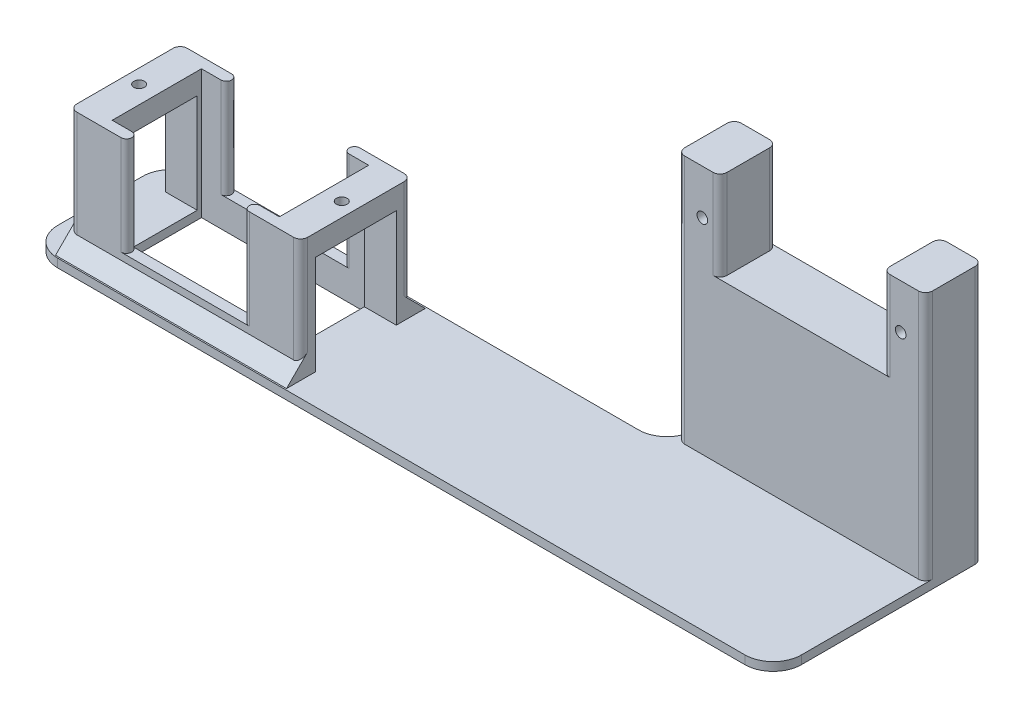
from build123d import *

# Parameters (mm, degrees)
ESBO_O1_W                = 35
ESBO_O1_H                = 9.5
ESBO_O1_W_2              = 105
ESBO_O1_H_2              = 20
BASE_DEPTH               = 1.2
ESBO_O2_W                = 32.6
ESBO_O2_H                = 15.6
SUPORTE_1_DEPTH          = 17
ESBO_O3_W                = 23.6
ESBO_O3_H                = 12.6
CORTE_EXTRUS_O1_DEPTH    = 19.5
ESBO_O4_W                = 16.6
ESBO_O4_H                = 17.237895569
CORTE_EXTRUS_O2_DEPTH    = 19.5
ESBO_O5_W                = 11.4
ESBO_O5_H                = 14
CORTE_EXTRUS_O3_DEPTH    = 36.5
ESBO_O6_R                = 0.75
CORTE_EXTRUS_O4_DEPTH    = 7.5
ESBO_O7_W                = 35
ESBO_O7_H                = 8
RESSALTO_EXTRUS_O3_DEPTH = 35.24
ESBO_O9_W                = 23
ESBO_O9_H                = 25.2
CORTE_EXTRUS_O5_DEPTH    = 22.5
ESBO_O10_R               = 0.75
CORTE_EXTRUS_O6_DEPTH    = 22.5
CHANFRO1_SIZE            = 2
CHANFRO2_SIZE            = 2
FILETE1_R                = 1
FILETE2_R                = 1
FILETE3_R                = 1
FILETE4_R                = 1
FILETE5_R                = 1
FILETE6_R                = 1
FILETE7_R                = 1
FILETE8_R                = 1
FILETE9_RADIUS           = 0.75
FILETE9_LENGTH           = 14
FILETE10_RADIUS          = 0.75
FILETE10_LENGTH          = 14
FILETE11_RADIUS          = 0.75
FILETE11_LENGTH          = 14
FILETE12_RADIUS          = 0.75
FILETE12_LENGTH          = 14
FILETE13_R               = 1
FILETE14_R               = 1
FILETE15_R               = 1
FILETE16_R               = 1
FILETE17_R               = 4
FILETE18_R               = 4
FILETE19_R               = 4
FILETE20_R               = 4


with BuildPart() as part:
    # Esboço1 → Base (new body)
    with BuildSketch(Plane(origin=(0, 0, 0), x_dir=(1, 0, 0), z_dir=(0, 1, 0))):
        with Locations((35, 14.75)):
            Rectangle(ESBO_O1_W, ESBO_O1_H)
        Rectangle(ESBO_O1_W_2, ESBO_O1_H_2)
    extrude(amount=BASE_DEPTH)

    # Esboço2 → Suporte 1 (add)
    with BuildSketch(Plane(origin=(0, 1.2, 0), x_dir=(1, 0, 0), z_dir=(0, 1, 0))):
        with Locations((-32.7, 0)):
            Rectangle(ESBO_O2_W, ESBO_O2_H)
    extrude(amount=SUPORTE_1_DEPTH)

    # Esboço3 → Corte-extrusão1 (cut)
    with BuildSketch(Plane(origin=(0, 18.2, 0), x_dir=(1, 0, 0), z_dir=(0, 1, 0))):
        with Locations((-32.7, 0)):
            Rectangle(ESBO_O3_W, ESBO_O3_H)
    extrude(amount=-CORTE_EXTRUS_O1_DEPTH, mode=Mode.SUBTRACT)

    # Esboço4 → Corte-extrusão2 (cut)
    with BuildSketch(Plane.XY.offset(7.8)):
        with Locations((-32.7, 12.818947785)):
            Rectangle(ESBO_O4_W, ESBO_O4_H)
    extrude(amount=-CORTE_EXTRUS_O2_DEPTH, mode=Mode.SUBTRACT)

    # Esboço5 → Corte-extrusão3 (cut)
    with BuildSketch(Plane(origin=(-16.4, 0, 0), x_dir=(0, 0, -1), z_dir=(1, 0, 0))):
        with Locations((0, 8.2)):
            Rectangle(ESBO_O5_W, ESBO_O5_H)
    extrude(amount=-CORTE_EXTRUS_O3_DEPTH, mode=Mode.SUBTRACT)

    # Esboço6 → Corte-extrusão4 (cut)
    with BuildSketch(Plane(origin=(0, 18.2, 0), x_dir=(1, 0, 0), z_dir=(0, 1, 0))):
        with Locations(Location((-47, 0, 0), (0, 0, 270))):
            Circle(ESBO_O6_R)
        with Locations(Location((-18.4, 0, 0), (0, 0, 270))):
            Circle(ESBO_O6_R)
    extrude(amount=-CORTE_EXTRUS_O4_DEPTH, mode=Mode.SUBTRACT)

    # Esboço7 → Ressalto-extrusão3 (add)
    with BuildSketch(Plane(origin=(0, 1.2, 0), x_dir=(1, 0, 0), z_dir=(0, 1, 0))):
        with Locations((35, 15.5)):
            Rectangle(ESBO_O7_W, ESBO_O7_H)
    extrude(amount=RESSALTO_EXTRUS_O3_DEPTH)

    # Esboço9 → Corte-extrusão5 (cut)
    with BuildSketch(Plane.XY.offset(-11.5)):
        with Locations((35, 36.44)):
            Rectangle(ESBO_O9_W, ESBO_O9_H)
    extrude(amount=-CORTE_EXTRUS_O5_DEPTH, mode=Mode.SUBTRACT)

    # Esboço10 → Corte-extrusão6 (cut)
    with BuildSketch(Plane.XY.offset(-11.5)):
        with Locations((21, 30.14)):
            Circle(ESBO_O10_R)
        with Locations((49, 30.14)):
            Circle(ESBO_O10_R)
    extrude(amount=-CORTE_EXTRUS_O6_DEPTH, mode=Mode.SUBTRACT)

    # Chanfro1
    chanfro1_edges = [part.edges().sort_by_distance(p)[0] for p in [
        (-32.7, 1.2, 7.8),
    ]]
    chamfer(chanfro1_edges, length=CHANFRO1_SIZE)

    # Chanfro2
    chanfro2_edges = [part.edges().sort_by_distance(p)[0] for p in [
        (-32.7, 1.2, -7.8),
    ]]
    chamfer(chanfro2_edges, length=CHANFRO2_SIZE)

    # Filete1
    filete1_edges = [part.edges().sort_by_distance(p)[0] for p in [
        (52.5, 18.22, -19.5),
    ]]
    fillet(filete1_edges, radius=FILETE1_R)

    # Filete2
    filete2_edges = [part.edges().sort_by_distance(p)[0] for p in [
        (17.5, 18.22, -19.5),
    ]]
    fillet(filete2_edges, radius=FILETE2_R)

    # Filete3
    filete3_edges = [part.edges().sort_by_distance(p)[0] for p in [
        (23.5, 30.14, -19.5),
    ]]
    fillet(filete3_edges, radius=FILETE3_R)

    # Filete4
    filete4_edges = [part.edges().sort_by_distance(p)[0] for p in [
        (46.5, 30.14, -19.5),
    ]]
    fillet(filete4_edges, radius=FILETE4_R)

    # Filete5
    filete5_edges = [part.edges().sort_by_distance(p)[0] for p in [
        (52.5, 18.82, -11.5),
    ]]
    fillet(filete5_edges, radius=FILETE5_R)

    # Filete6
    filete6_edges = [part.edges().sort_by_distance(p)[0] for p in [
        (17.5, 18.82, -11.5),
    ]]
    fillet(filete6_edges, radius=FILETE6_R)

    # Filete7
    filete7_edges = [part.edges().sort_by_distance(p)[0] for p in [
        (46.5, 30.14, -11.5),
    ]]
    fillet(filete7_edges, radius=FILETE7_R)

    # Filete8
    filete8_edges = [part.edges().sort_by_distance(p)[0] for p in [
        (23.5, 30.14, -11.5),
    ]]
    fillet(filete8_edges, radius=FILETE8_R)

    # Filete9: full round fillet: the end face becomes a half cylinder, R = half its width
    filete9_face = Plane((-41, 11.2, 7.05), x_dir=(0, -1, 0), z_dir=(1, 0, 0))  # on the end face: x along it, z out of the body
    filete9_slab = filete9_face.offset(-FILETE9_RADIUS / 2) * Box(FILETE9_LENGTH, 2 * FILETE9_RADIUS, FILETE9_RADIUS, mode=Mode.PRIVATE)  # the body's end, R deep
    filete9_round = Plane((-41.75, 11.2, 7.05), x_dir=(1, 0, 0), z_dir=(0, -1, 0)) * Cylinder(FILETE9_RADIUS, FILETE9_LENGTH, mode=Mode.PRIVATE)  # its axis R under the face
    add(filete9_slab - filete9_round, mode=Mode.SUBTRACT)

    # Filete10: full round fillet: the end face becomes a half cylinder, R = half its width
    filete10_face = Plane((-41, 11.2, -7.05), x_dir=(0, -1, 0), z_dir=(1, 0, 0))  # on the end face: x along it, z out of the body
    filete10_slab = filete10_face.offset(-FILETE10_RADIUS / 2) * Box(FILETE10_LENGTH, 2 * FILETE10_RADIUS, FILETE10_RADIUS, mode=Mode.PRIVATE)  # the body's end, R deep
    filete10_round = Plane((-41.75, 11.2, -7.05), x_dir=(1, 0, 0), z_dir=(0, -1, 0)) * Cylinder(FILETE10_RADIUS, FILETE10_LENGTH, mode=Mode.PRIVATE)  # its axis R under the face
    add(filete10_slab - filete10_round, mode=Mode.SUBTRACT)

    # Filete11: full round fillet: the end face becomes a half cylinder, R = half its width
    filete11_face = Plane((-24.4, 11.2, 7.05), x_dir=(0, 1, 0), z_dir=(-1, 0, 0))  # on the end face: x along it, z out of the body
    filete11_slab = filete11_face.offset(-FILETE11_RADIUS / 2) * Box(FILETE11_LENGTH, 2 * FILETE11_RADIUS, FILETE11_RADIUS, mode=Mode.PRIVATE)  # the body's end, R deep
    filete11_round = Plane((-23.65, 11.2, 7.05), x_dir=(-1, 0, 0), z_dir=(0, 1, 0)) * Cylinder(FILETE11_RADIUS, FILETE11_LENGTH, mode=Mode.PRIVATE)  # its axis R under the face
    add(filete11_slab - filete11_round, mode=Mode.SUBTRACT)

    # Filete12: full round fillet: the end face becomes a half cylinder, R = half its width
    filete12_face = Plane((-24.4, 11.2, -7.05), x_dir=(0, 1, 0), z_dir=(-1, 0, 0))  # on the end face: x along it, z out of the body
    filete12_slab = filete12_face.offset(-FILETE12_RADIUS / 2) * Box(FILETE12_LENGTH, 2 * FILETE12_RADIUS, FILETE12_RADIUS, mode=Mode.PRIVATE)  # the body's end, R deep
    filete12_round = Plane((-23.65, 11.2, -7.05), x_dir=(-1, 0, 0), z_dir=(0, 1, 0)) * Cylinder(FILETE12_RADIUS, FILETE12_LENGTH, mode=Mode.PRIVATE)  # its axis R under the face
    add(filete12_slab - filete12_round, mode=Mode.SUBTRACT)

    # Filete13
    filete13_edges = [part.edges().sort_by_distance(p)[0] for p in [
        (-49, 10.7, -7.8),
    ]]
    fillet(filete13_edges, radius=FILETE13_R)

    # Filete14
    filete14_edges = [part.edges().sort_by_distance(p)[0] for p in [
        (-49, 10.7, 7.8),
    ]]
    fillet(filete14_edges, radius=FILETE14_R)

    # Filete15
    filete15_edges = [part.edges().sort_by_distance(p)[0] for p in [
        (-16.4, 10.7, 7.8),
    ]]
    fillet(filete15_edges, radius=FILETE15_R)

    # Filete16
    filete16_edges = [part.edges().sort_by_distance(p)[0] for p in [
        (-16.4, 10.7, -7.8),
    ]]
    fillet(filete16_edges, radius=FILETE16_R)

    # Filete17
    filete17_edges = [part.edges().sort_by_distance(p)[0] for p in [
        (-52.5, 0.6, 10),
    ]]
    fillet(filete17_edges, radius=FILETE17_R)

    # Filete18
    filete18_edges = [part.edges().sort_by_distance(p)[0] for p in [
        (-52.5, 0.6, -10),
    ]]
    fillet(filete18_edges, radius=FILETE18_R)

    # Filete19
    filete19_edges = [part.edges().sort_by_distance(p)[0] for p in [
        (52.5, 0.6, 10),
    ]]
    fillet(filete19_edges, radius=FILETE19_R)

    # Filete20
    # the kernel refuses this fillet: 4 mm, written as the material it adds along each edge
    with BuildSketch(Plane(origin=(17.5, 0, -10), x_dir=(-1, 0, 0), z_dir=(0, 1, 0))) as filete20_piece_1:
        with BuildLine():
            CenterArc((FILETE20_R, -FILETE20_R), FILETE20_R, 90, 90)
            Line((0, -FILETE20_R), (0, 0))
            Line((0, 0), (FILETE20_R, 0))
        make_face()
    extrude(amount=1.2)


solid = part.part
